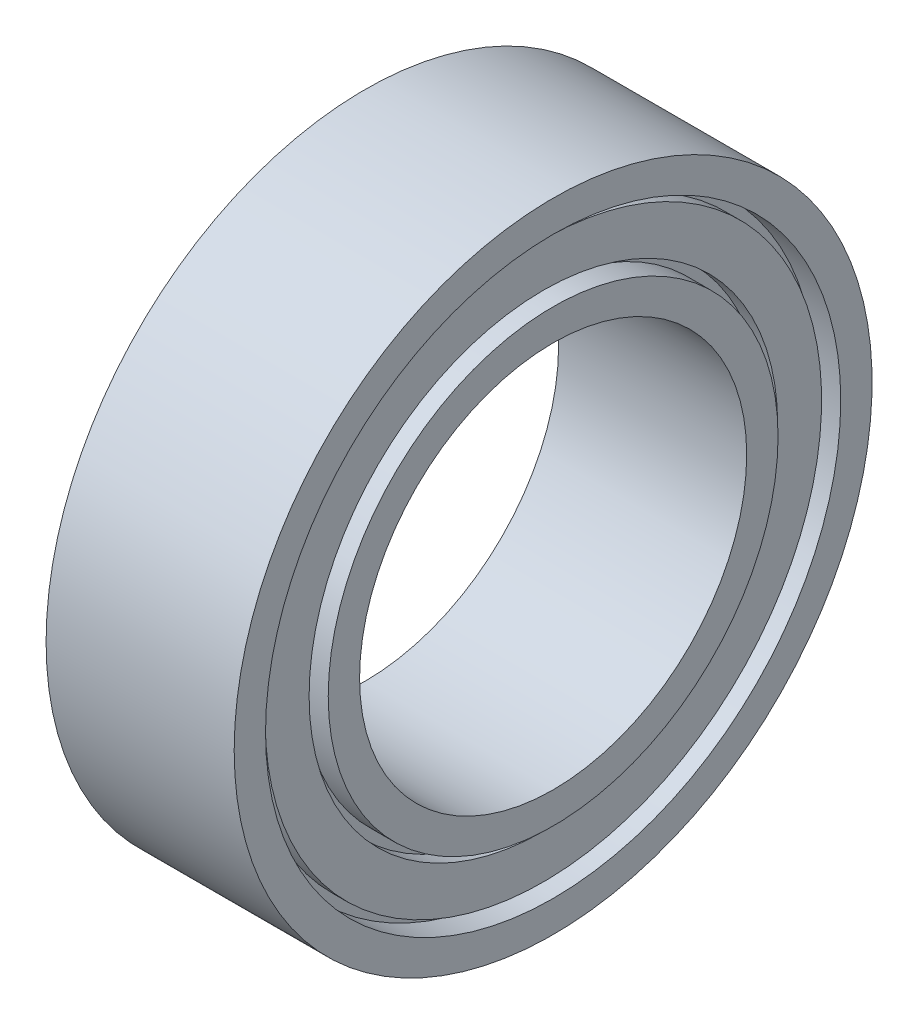
from build123d import *


with BuildPart() as part:
    # Sketch1 → Revolve1 (revolve)
    with BuildSketch(Plane.XY):
        Polygon((-1.5, 3.087093808), (1.5, 3.087093808), (1.5, 3.587093808), (1.1, 3.587093808), (1.1, 3.737093808), (1.344796779, 3.737093808), (1.344796779, 4.437093808), (1.1, 4.437093808), (1.1, 4.587093808), (1.5, 4.587093808), (1.5, 5.087093808), (-1.5, 5.087093808), (-1.5, 4.587093808), (-1.1, 4.587093808), (-1.1, 4.437093808), (-1.344796779, 4.437093808), (-1.344796779, 3.737093808), (-1.1, 3.737093808), (-1.1, 3.587093808), (-1.5, 3.587093808), align=None)
    revolve(axis=Axis((-2.67919432, 0, 0), (1, 0, 0)))


solid = part.part
